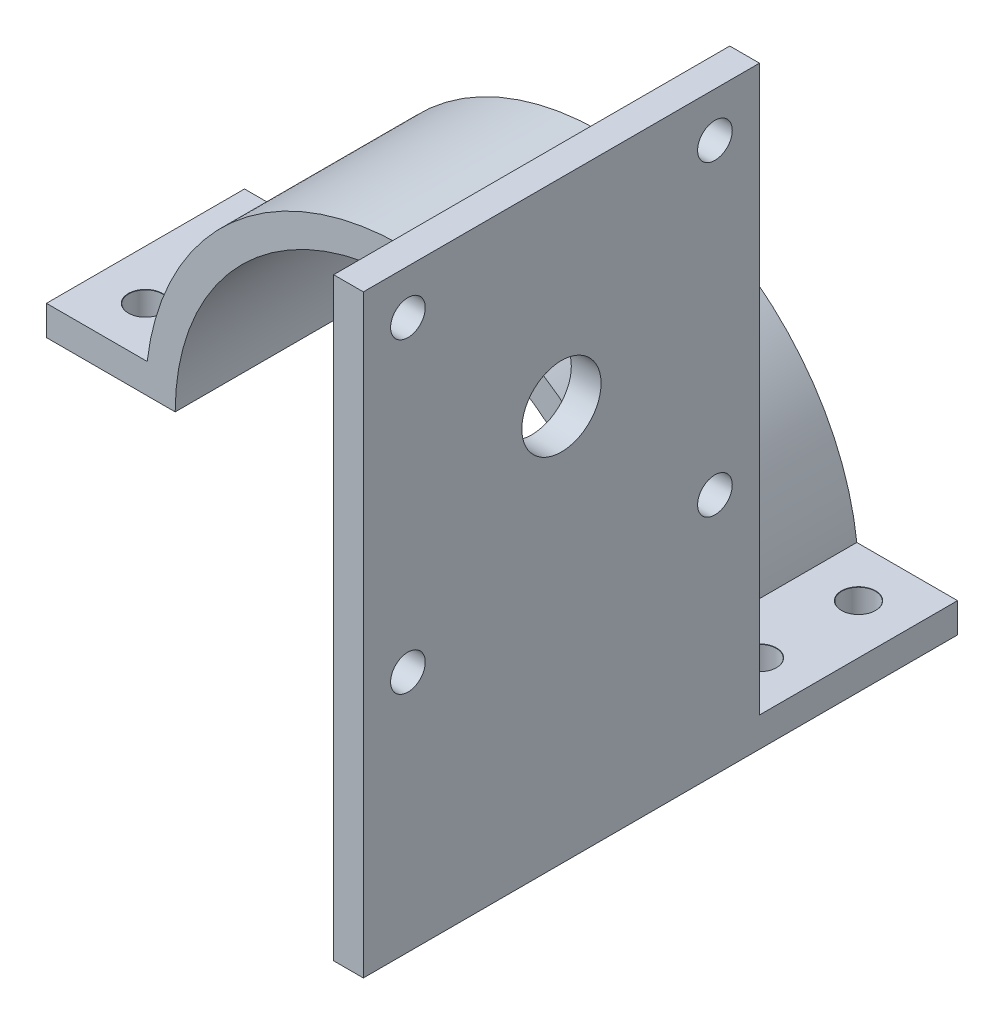
from build123d import *

# Parameters (mm, degrees)
EXTRUDE_1_DEPTH     = 20
SKETCH_2_W          = 13
SKETCH_2_H          = 3
EXTRUDE_2_DEPTH     = 20
SKETCH_5_W          = 3
SKETCH_5_H          = 40
EXTRUDE_3_DEPTH     = 60
CUT_EXTRUDE_1_REACH = 113.283
SKETCH_6_R          = 4
SKETCH_6_R_2        = 1.75


# Read off the part's stored shape, not the designer's step: M3 すきま穴1
with BuildPart() as part:
    # ｽｹｯﾁ1 → ﾎﾞｽ - 押し出し1 (new body)
    with BuildSketch(Plane.XY):
        with BuildLine():
            Line((-23, 0), (-26, 0))
            ThreePointArc((-26, 0), (0, 26), (26, 0))
            Line((26, 0), (23, 0))
            ThreePointArc((23, 0), (0, 23), (-23, 0))
        make_face()
    extrude(amount=EXTRUDE_1_DEPTH)

    # ｽｹｯﾁ2 → ﾎﾞｽ - 押し出し2 (add)
    with BuildSketch(Plane.XY.offset(20)):
        with Locations((-29.5, 1.5)):
            Rectangle(SKETCH_2_W, SKETCH_2_H)
        with Locations((29.5, 1.5)):
            Rectangle(SKETCH_2_W, SKETCH_2_H)
    extrude(amount=-EXTRUDE_2_DEPTH)

    # M3 すきま穴1 outline → M3 すきま穴1 (revolve, cut)
    with BuildSketch(Plane(origin=(31, 0, 15), x_dir=(1, 0, 0), z_dir=(0, 0, 1))):
        Polygon((0, 0), (1.7, 0), (1.7, 2.97124079), (1.725, 3), (0, 3), align=None)
    revolve(axis=Axis((31, 0, 15), (0, 1, 0)), mode=Mode.SUBTRACT)

    # Hole Wizard M3 _1 2 outline → Hole Wizard M3 _1 2 (revolve, cut)
    with BuildSketch(Plane(origin=(31, 0, 5), x_dir=(1, 0, 0), z_dir=(0, 0, 1))):
        Polygon((0, 0), (1.7, 0), (1.7, 2.97124079), (1.725, 3), (0, 3), align=None)
    revolve(axis=Axis((31, 0, 5), (0, 1, 0)), mode=Mode.SUBTRACT)

    # Hole Wizard M3 _1 3 outline → Hole Wizard M3 _1 3 (revolve, cut)
    with BuildSketch(Plane(origin=(-31, 0, 15), x_dir=(1, 0, 0), z_dir=(0, 0, 1))):
        Polygon((0, 0), (1.7, 0), (1.7, 2.97124079), (1.725, 3), (0, 3), align=None)
    revolve(axis=Axis((-31, 0, 15), (0, 1, 0)), mode=Mode.SUBTRACT)

    # Hole Wizard M3 _1 4 outline → Hole Wizard M3 _1 4 (revolve, cut)
    with BuildSketch(Plane(origin=(-31, 0, 5), x_dir=(1, 0, 0), z_dir=(0, 0, 1))):
        Polygon((0, 0), (1.7, 0), (1.7, 2.97124079), (1.725, 3), (0, 3), align=None)
    revolve(axis=Axis((-31, 0, 5), (0, 1, 0)), mode=Mode.SUBTRACT)

    # ｽｹｯﾁ5 → ﾎﾞｽ - 押し出し3 (add)
    with BuildSketch(Plane.XZ):
        with Locations((34.5, 40)):
            Rectangle(SKETCH_5_W, SKETCH_5_H)
    extrude(amount=-EXTRUDE_3_DEPTH)

    # ｽｹｯﾁ6 → ｶｯﾄ - 押し出し1 (cut, up to next)
    with BuildSketch(Plane(origin=(36, 0, 0), x_dir=(0, 0, -1), z_dir=(1, 0, 0)), mode=Mode.PRIVATE) as cut_extrude_1_sk1:
        with Locations((-40, 40)):
            Circle(SKETCH_6_R)
    cut_extrude_1_tool1 = extrude(cut_extrude_1_sk1.sketch, amount=-CUT_EXTRUDE_1_REACH, mode=Mode.PRIVATE) & part.part
    # ｽｹｯﾁ6 → ｶｯﾄ - 押し出し1 (cut, up to next)
    with BuildSketch(Plane(origin=(36, 0, 0), x_dir=(0, 0, -1), z_dir=(1, 0, 0)), mode=Mode.PRIVATE) as cut_extrude_1_sk2:
        with Locations((-24.5, 55.5)):
            Circle(SKETCH_6_R_2)
    cut_extrude_1_tool2 = extrude(cut_extrude_1_sk2.sketch, amount=-CUT_EXTRUDE_1_REACH, mode=Mode.PRIVATE) & part.part
    # ｽｹｯﾁ6 → ｶｯﾄ - 押し出し1 (cut, up to next)
    with BuildSketch(Plane(origin=(36, 0, 0), x_dir=(0, 0, -1), z_dir=(1, 0, 0)), mode=Mode.PRIVATE) as cut_extrude_1_sk3:
        with Locations((-24.5, 24.5)):
            Circle(SKETCH_6_R_2)
    cut_extrude_1_tool3 = extrude(cut_extrude_1_sk3.sketch, amount=-CUT_EXTRUDE_1_REACH, mode=Mode.PRIVATE) & part.part
    # ｽｹｯﾁ6 → ｶｯﾄ - 押し出し1 (cut, up to next)
    with BuildSketch(Plane(origin=(36, 0, 0), x_dir=(0, 0, -1), z_dir=(1, 0, 0)), mode=Mode.PRIVATE) as cut_extrude_1_sk4:
        with Locations((-55.5, 24.5)):
            Circle(SKETCH_6_R_2)
    cut_extrude_1_tool4 = extrude(cut_extrude_1_sk4.sketch, amount=-CUT_EXTRUDE_1_REACH, mode=Mode.PRIVATE) & part.part
    # ｽｹｯﾁ6 → ｶｯﾄ - 押し出し1 (cut, up to next)
    with BuildSketch(Plane(origin=(36, 0, 0), x_dir=(0, 0, -1), z_dir=(1, 0, 0)), mode=Mode.PRIVATE) as cut_extrude_1_sk5:
        with Locations((-55.5, 55.5)):
            Circle(SKETCH_6_R_2)
    cut_extrude_1_tool5 = extrude(cut_extrude_1_sk5.sketch, amount=-CUT_EXTRUDE_1_REACH, mode=Mode.PRIVATE) & part.part
    add(cut_extrude_1_tool1.solids().sort_by_distance((36, 40, 40))[0], mode=Mode.SUBTRACT)
    add(cut_extrude_1_tool2.solids().sort_by_distance((36, 55.5, 24.5))[0], mode=Mode.SUBTRACT)
    add(cut_extrude_1_tool3.solids().sort_by_distance((36, 24.5, 24.5))[0], mode=Mode.SUBTRACT)
    add(cut_extrude_1_tool4.solids().sort_by_distance((36, 24.5, 55.5))[0], mode=Mode.SUBTRACT)
    add(cut_extrude_1_tool5.solids().sort_by_distance((36, 55.5, 55.5))[0], mode=Mode.SUBTRACT)


solid = part.part
